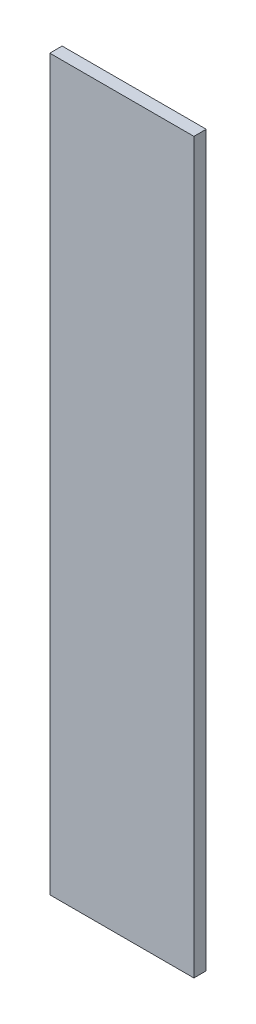
from build123d import *

# Parameters (mm, degrees)
SKETCH1_W           = 35
SKETCH1_H           = 177
BOSS_EXTRUDE1_DEPTH = 3


with BuildPart() as part:
    # Sketch1 → Boss-Extrude1 (new body)
    with BuildSketch(Plane.XY):
        Rectangle(SKETCH1_W, SKETCH1_H)
    extrude(amount=BOSS_EXTRUDE1_DEPTH)


solid = part.part
